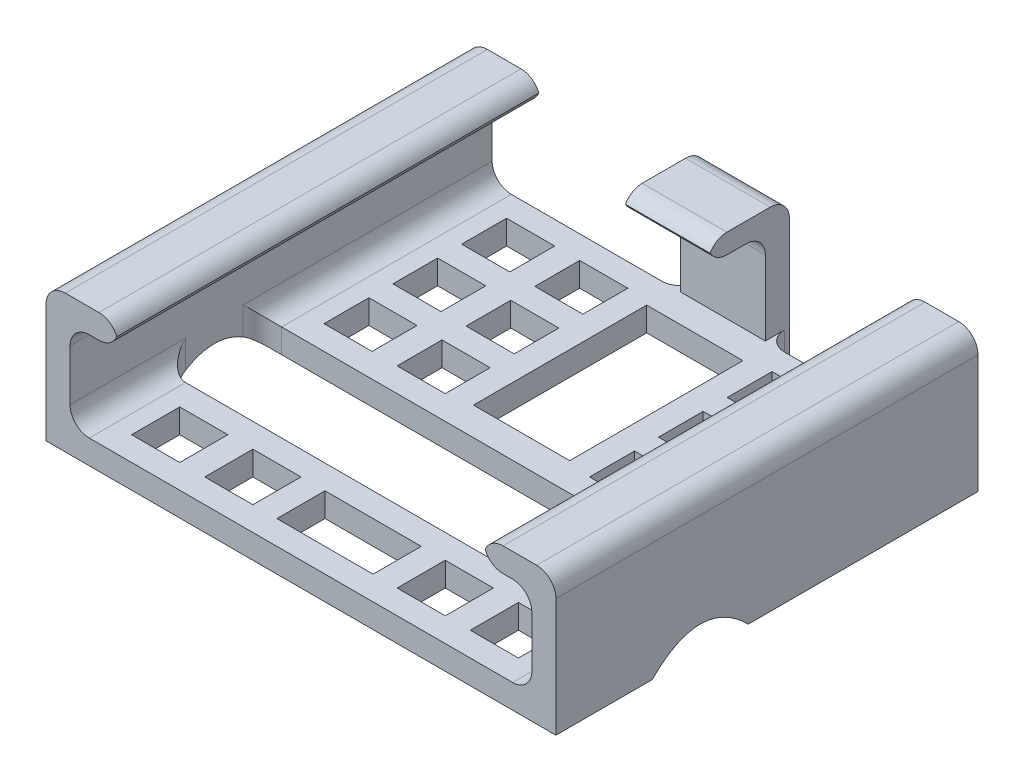
from build123d import *

# Parameters (mm, degrees)
SKETCH1_W                = 27.858627607
SKETCH1_H                = 1.5875
BOSS_EXTRUDE1_DEPTH      = 3.175
BOSS_EXTRUDE2_DEPTH      = 7.493
BOSS_EXTRUDE2_DEPTH_BACK = 1.5875
SKETCH2_W                = 1.5875
SKETCH2_H                = 27.858627607
SKETCH6_W                = 15.161065851
SKETCH6_H                = 1.5875
SKETCH6_W_2              = 6.350812748
BOSS_EXTRUDE3_DEPTH      = 30.48
SKETCH8_W                = 3.175
SKETCH8_H                = 2.963333334
SKETCH8_H_2              = 2.947899184
SKETCH8_W_2              = 6.35
SKETCH8_H_3              = 11.43
SKETCH8_H_4              = 3.175812748
SKETCH8_H_5              = 2.963333333
CUT_EXTRUDE5_DEPTH       = 1.5875
SKETCH9_W                = 5.588
SKETCH9_H                = 1.5875
BOSS_EXTRUDE4_DEPTH      = 1.5875
SKETCH10_W               = 5.588
SKETCH10_H               = 1.5875
BOSS_EXTRUDE5_DEPTH      = 7.493
SKETCH11_W               = 5.588
SKETCH11_H               = 1.299643063
BOSS_EXTRUDE6_DEPTH      = 3.81
FILLET1_R                = 1.27
CUT_EXTRUDE6_DEPTH       = 33.02
CUT_EXTRUDE6_DEPTH_BACK  = 2.54


with BuildPart() as part:
    # Sketch1 → Boss-Extrude1 (new body)
    with BuildSketch(Plane(origin=(15.758285748, 0, 0), x_dir=(0, 0, -1), z_dir=(1, 0, 0))):
        with Locations((-0.057440838, -17.304581801)):
            Rectangle(SKETCH1_W, SKETCH1_H)
    extrude(amount=-BOSS_EXTRUDE1_DEPTH)

    # Sketch2 → Boss-Extrude2 (add, two sides: drawn at the far end of the back side and taken through both)
    with BuildSketch(Plane.XZ.offset(18.098331801).offset(-BOSS_EXTRUDE2_DEPTH_BACK)):
        with Locations((16.552035748, 0.057440838)):
            Rectangle(SKETCH2_W, SKETCH2_H)
    extrude(amount=BOSS_EXTRUDE2_DEPTH + BOSS_EXTRUDE2_DEPTH_BACK)


with BuildPart() as body_2:
    # Mirror5: mirrored copy
    add(part.part.mirror(Plane(origin=(0.518285748, 0, 0), x_dir=(0, 0, 1), z_dir=(1, 0, 0))))


with BuildPart() as part_1:
    add(part.part)

    add(body_2.part)  # Boss-Extrude3 merges body 2
    # Sketch6 → Boss-Extrude3 (add)
    with BuildSketch(Plane.ZY.offset(-15.758285748)):
        with Locations((-6.29134004, -24.797581801)):
            Rectangle(SKETCH6_W, SKETCH6_H)
        with Locations((10.811348268, -24.797581801)):
            Rectangle(SKETCH6_W_2, SKETCH6_H)
    extrude(amount=BOSS_EXTRUDE3_DEPTH)

    # Sketch8 → Cut-Extrude5 (cut)
    with BuildSketch(Plane(origin=(0, -24.003831801, 0), x_dir=(1, 0, 0), z_dir=(0, 1, 0))):
        with Locations((-10.657714252, 1.779973781)):
            Rectangle(SKETCH8_W, SKETCH8_H)
        with Locations((-10.657714252, 6.32309004)):
            Rectangle(SKETCH8_W, SKETCH8_H_2)
        with Locations((0.518285748, 6.29134004)):
            Rectangle(SKETCH8_W_2, SKETCH8_H_3)
        with Locations((-5.831714252, 1.779973781)):
            Rectangle(SKETCH8_W, SKETCH8_H)
        with Locations((-10.657714252, -10.811348268)):
            Rectangle(SKETCH8_W, SKETCH8_H_4)
        with Locations((-5.831714252, 6.32309004)):
            Rectangle(SKETCH8_W, SKETCH8_H_2)
        with Locations((-5.831714252, 10.866206298)):
            Rectangle(SKETCH8_W, SKETCH8_H_5)
        with Locations((-10.657714252, 10.866206298)):
            Rectangle(SKETCH8_W, SKETCH8_H_5)
        with Locations((11.694285748, 10.866206298)):
            Rectangle(SKETCH8_W, SKETCH8_H_5)
        with Locations((6.868285748, 10.866206298)):
            Rectangle(SKETCH8_W, SKETCH8_H_5)
        with Locations((6.868285748, 6.32309004)):
            Rectangle(SKETCH8_W, SKETCH8_H_2)
        with Locations((11.694285748, 6.32309004)):
            Rectangle(SKETCH8_W, SKETCH8_H_2)
        with Locations((6.868285748, 1.779973781)):
            Rectangle(SKETCH8_W, SKETCH8_H)
        with Locations((11.694285748, 1.779973781)):
            Rectangle(SKETCH8_W, SKETCH8_H)
        with Locations((-5.831714252, -10.811348268)):
            Rectangle(SKETCH8_W, SKETCH8_H_4)
        with Locations((6.868285748, -10.811348268)):
            Rectangle(SKETCH8_W, SKETCH8_H_4)
        with Locations((11.694285748, -10.811348268)):
            Rectangle(SKETCH8_W, SKETCH8_H_4)
        with Locations((0.518285748, -10.811348268)):
            Rectangle(SKETCH8_W_2, SKETCH8_H_4)
    extrude(amount=-CUT_EXTRUDE5_DEPTH, mode=Mode.SUBTRACT)

    # Sketch9 → Boss-Extrude4 (add)
    with BuildSketch(Plane(origin=(0, 0, -13.871872965), x_dir=(-1, 0, 0), z_dir=(0, 0, -1))):
        with Locations((-0.518285748, -24.797581801)):
            Rectangle(SKETCH9_W, SKETCH9_H)
    extrude(amount=BOSS_EXTRUDE4_DEPTH)

    # Sketch10 → Boss-Extrude5 (add)
    with BuildSketch(Plane(origin=(0, -24.003831801, 0), x_dir=(1, 0, 0), z_dir=(0, 1, 0))):
        with Locations((0.518285748, 14.665622965)):
            Rectangle(SKETCH10_W, SKETCH10_H)
    extrude(amount=BOSS_EXTRUDE5_DEPTH)

    # Sketch11 → Boss-Extrude6 (add)
    with BuildSketch(Plane.XY.offset(-13.871872965)):
        with Locations((0.518285748, -17.160653333)):
            Rectangle(SKETCH11_W, SKETCH11_H)
    extrude(amount=BOSS_EXTRUDE6_DEPTH)

    # Fillet1
    # the kernel refuses this fillet: 1.27 mm, written as the material it adds along each edge
    with BuildSketch(Plane(origin=(-14.721714252, -18.098331801, 13.986754642), x_dir=(1, 0, 0), z_dir=(0, 0, -1)), Plane(origin=(15.758285748, -18.098331801, 13.986754642), x_dir=(0, -1, 0), z_dir=(0, 0, -1))) as fillet1_piece_1:
        with BuildLine():
            CenterArc((FILLET1_R, FILLET1_R), FILLET1_R, 180, 90)
            Line((0, FILLET1_R), (-FILLET1_R * 0.02, FILLET1_R))
            Line((-FILLET1_R * 0.02, FILLET1_R), (-FILLET1_R * 0.02, -FILLET1_R * 0.02))
            Line((-FILLET1_R * 0.02, -FILLET1_R * 0.02), (FILLET1_R, -FILLET1_R * 0.02))
            Line((FILLET1_R, -FILLET1_R * 0.02), (FILLET1_R, 0))
        make_face()
    extrude(amount=27.858627606)
    with BuildSketch(Plane(origin=(15.758285748, -24.003831801, 7.635941894), x_dir=(-1, 0, 0), z_dir=(0, 0, 1))) as fillet1_piece_2:
        with BuildLine():
            CenterArc((FILLET1_R, -FILLET1_R), FILLET1_R, 90, 90)
            Line((0, -FILLET1_R), (-FILLET1_R * 0.02, -FILLET1_R))
            Line((-FILLET1_R * 0.02, -FILLET1_R), (-FILLET1_R * 0.02, FILLET1_R * 0.02))
            Line((-FILLET1_R * 0.02, FILLET1_R * 0.02), (FILLET1_R, FILLET1_R * 0.02))
            Line((FILLET1_R, FILLET1_R * 0.02), (FILLET1_R, 0))
        make_face()
    extrude(amount=6.350812748)
    with BuildSketch(Plane(origin=(-14.721714252, -24.003831801, 7.635941894), x_dir=(1, 0, 0), z_dir=(0, 0, 1))) as fillet1_piece_3:
        with BuildLine():
            CenterArc((FILLET1_R, FILLET1_R), FILLET1_R, 180, 90)
            Line((0, FILLET1_R), (-FILLET1_R * 0.02, FILLET1_R))
            Line((-FILLET1_R * 0.02, FILLET1_R), (-FILLET1_R * 0.02, -FILLET1_R * 0.02))
            Line((-FILLET1_R * 0.02, -FILLET1_R * 0.02), (FILLET1_R, -FILLET1_R * 0.02))
            Line((FILLET1_R, -FILLET1_R * 0.02), (FILLET1_R, 0))
        make_face()
    extrude(amount=6.350812748)
    with BuildSketch(Plane(origin=(15.758285748, -25.591331801, 7.635941894), x_dir=(-1, 0, 0), z_dir=(0, 1, 0)), Plane(origin=(15.758285748, -25.591331801, 1.289192886), x_dir=(0, 0, 1), z_dir=(0, 1, 0)), Plane(origin=(-14.721714252, -25.591331801, 1.289192886), x_dir=(1, 0, 0), z_dir=(0, 1, 0))) as fillet1_piece_4:
        with BuildLine():
            CenterArc((FILLET1_R, -FILLET1_R), FILLET1_R, 90, 90)
            Line((0, -FILLET1_R), (-FILLET1_R * 0.02, -FILLET1_R))
            Line((-FILLET1_R * 0.02, -FILLET1_R), (-FILLET1_R * 0.02, FILLET1_R * 0.02))
            Line((-FILLET1_R * 0.02, FILLET1_R * 0.02), (FILLET1_R, FILLET1_R * 0.02))
            Line((FILLET1_R, FILLET1_R * 0.02), (FILLET1_R, 0))
        make_face()
    extrude(amount=1.5875)
    with BuildSketch(Plane(origin=(-14.721714252, -25.591331801, 7.635941894), x_dir=(1, 0, 0), z_dir=(0, 1, 0))) as fillet1_piece_5:
        with BuildLine():
            CenterArc((FILLET1_R, FILLET1_R), FILLET1_R, 180, 90)
            Line((0, FILLET1_R), (-FILLET1_R * 0.02, FILLET1_R))
            Line((-FILLET1_R * 0.02, FILLET1_R), (-FILLET1_R * 0.02, -FILLET1_R * 0.02))
            Line((-FILLET1_R * 0.02, -FILLET1_R * 0.02), (FILLET1_R, -FILLET1_R * 0.02))
            Line((FILLET1_R, -FILLET1_R * 0.02), (FILLET1_R, 0))
        make_face()
    extrude(amount=1.5875)
    with BuildSketch(Plane(origin=(15.758285748, -24.003831801, 1.289192886), x_dir=(0, 1, 0), z_dir=(0, 0, -1)), Plane(origin=(-14.721714252, -24.003831801, 1.289192886), x_dir=(1, 0, 0), z_dir=(0, 0, -1))) as fillet1_piece_6:
        with BuildLine():
            CenterArc((FILLET1_R, -FILLET1_R), FILLET1_R, 90, 90)
            Line((0, -FILLET1_R), (-FILLET1_R * 0.02, -FILLET1_R))
            Line((-FILLET1_R * 0.02, -FILLET1_R), (-FILLET1_R * 0.02, FILLET1_R * 0.02))
            Line((-FILLET1_R * 0.02, FILLET1_R * 0.02), (FILLET1_R, FILLET1_R * 0.02))
            Line((FILLET1_R, FILLET1_R * 0.02), (FILLET1_R, 0))
        make_face()
    extrude(amount=15.16106585)
    with BuildSketch(Plane(origin=(-2.275714252, -17.810474864, -13.871872965), x_dir=(0, -1, 0), z_dir=(1, 0, 0))) as fillet1_piece_7:
        with BuildLine():
            CenterArc((FILLET1_R, -FILLET1_R), FILLET1_R, 90, 90)
            Line((0, -FILLET1_R), (-FILLET1_R * 0.02, -FILLET1_R))
            Line((-FILLET1_R * 0.02, -FILLET1_R), (-FILLET1_R * 0.02, FILLET1_R * 0.02))
            Line((-FILLET1_R * 0.02, FILLET1_R * 0.02), (FILLET1_R, FILLET1_R * 0.02))
            Line((FILLET1_R, FILLET1_R * 0.02), (FILLET1_R, 0))
        make_face()
    extrude(amount=5.588)
    with BuildSketch(Plane(origin=(-2.275714252, -25.591331801, -13.871872965), x_dir=(0, 0, -1), z_dir=(0, 1, 0))) as fillet1_piece_8_section:
        with BuildLine():
            CenterArc((FILLET1_R, FILLET1_R), FILLET1_R, 180, 90)
            Line((0, FILLET1_R), (-FILLET1_R * 0.02, FILLET1_R))
            Line((-FILLET1_R * 0.02, FILLET1_R), (-FILLET1_R * 0.02, -FILLET1_R * 0.02))
            Line((-FILLET1_R * 0.02, -FILLET1_R * 0.02), (FILLET1_R, -FILLET1_R * 0.02))
            Line((FILLET1_R, -FILLET1_R * 0.02), (FILLET1_R, 0))
        make_face()
    fillet1_piece_8 = extrude(amount=1.5875, mode=Mode.PRIVATE)
    fillet1_piece_8 = split(fillet1_piece_8, bisect_by=Plane(origin=(-2.534125127, -24.797581801, -13.871872965), z_dir=(0, 0, -1)), keep=Keep.TOP, mode=Mode.PRIVATE)
    add(fillet1_piece_8)
    with BuildSketch(Plane(origin=(3.312285748, -24.003831801, -13.871872965), x_dir=(0, 0, -1), z_dir=(0, -1, 0))) as fillet1_piece_9_section:
        with BuildLine():
            CenterArc((FILLET1_R, FILLET1_R), FILLET1_R, 180, 90)
            Line((0, FILLET1_R), (-FILLET1_R * 0.02, FILLET1_R))
            Line((-FILLET1_R * 0.02, FILLET1_R), (-FILLET1_R * 0.02, -FILLET1_R * 0.02))
            Line((-FILLET1_R * 0.02, -FILLET1_R * 0.02), (FILLET1_R, -FILLET1_R * 0.02))
            Line((FILLET1_R, -FILLET1_R * 0.02), (FILLET1_R, 0))
        make_face()
    fillet1_piece_9 = extrude(amount=1.5875, mode=Mode.PRIVATE)
    fillet1_piece_9 = split(fillet1_piece_9, bisect_by=Plane(origin=(3.570696623, -24.797581801, -13.871872965), z_dir=(0, 0, -1)), keep=Keep.TOP, mode=Mode.PRIVATE)
    add(fillet1_piece_9)
    with BuildSketch(Plane(origin=(15.758285748, -24.003831801, 4.460941894), x_dir=(-1, 0, 0), z_dir=(0, 0, 1))) as fillet1_piece_10a_section:
        with BuildLine():
            CenterArc((FILLET1_R, -FILLET1_R), FILLET1_R, 90, 90)
            Line((0, -FILLET1_R), (-FILLET1_R * 0.02, -FILLET1_R))
            Line((-FILLET1_R * 0.02, -FILLET1_R), (-FILLET1_R * 0.02, FILLET1_R * 0.02))
            Line((-FILLET1_R * 0.02, FILLET1_R * 0.02), (FILLET1_R, FILLET1_R * 0.02))
            Line((FILLET1_R, FILLET1_R * 0.02), (FILLET1_R, 0))
        make_face()
    fillet1_piece_10a = extrude(amount=9.525812748, mode=Mode.PRIVATE)
    fillet1_piece_10a = split(fillet1_piece_10a, bisect_by=Plane(origin=(15.470763953, -23.716310006, 7.635941894), z_dir=(0, 0, -1)), keep=Keep.TOP, mode=Mode.PRIVATE)
    with BuildSketch(Plane(origin=(15.758285748, -25.591331801, 7.635941894), x_dir=(-1, 0, 0), z_dir=(0, 1, 0))) as fillet1_piece_10b_section:
        with BuildLine():
            CenterArc((FILLET1_R, -FILLET1_R), FILLET1_R, 90, 90)
            Line((0, -FILLET1_R), (-FILLET1_R * 0.02, -FILLET1_R))
            Line((-FILLET1_R * 0.02, -FILLET1_R), (-FILLET1_R * 0.02, FILLET1_R * 0.02))
            Line((-FILLET1_R * 0.02, FILLET1_R * 0.02), (FILLET1_R, FILLET1_R * 0.02))
            Line((FILLET1_R, FILLET1_R * 0.02), (FILLET1_R, 0))
        make_face()
    fillet1_piece_10b = extrude(amount=4.7625, mode=Mode.PRIVATE)
    fillet1_piece_10b = split(fillet1_piece_10b, bisect_by=Plane(origin=(15.470763953, -24.003831801, 7.348420099), z_dir=(0, 1, 0)), keep=Keep.TOP, mode=Mode.PRIVATE)
    fillet1_piece_10 = fillet1_piece_10a & fillet1_piece_10b
    add(fillet1_piece_10)
    with BuildSketch(Plane(origin=(-14.721714252, -24.003831801, 4.460941894), x_dir=(1, 0, 0), z_dir=(0, 0, 1))) as fillet1_piece_11a_section:
        with BuildLine():
            CenterArc((FILLET1_R, FILLET1_R), FILLET1_R, 180, 90)
            Line((0, FILLET1_R), (-FILLET1_R * 0.02, FILLET1_R))
            Line((-FILLET1_R * 0.02, FILLET1_R), (-FILLET1_R * 0.02, -FILLET1_R * 0.02))
            Line((-FILLET1_R * 0.02, -FILLET1_R * 0.02), (FILLET1_R, -FILLET1_R * 0.02))
            Line((FILLET1_R, -FILLET1_R * 0.02), (FILLET1_R, 0))
        make_face()
    fillet1_piece_11a = extrude(amount=9.525812748, mode=Mode.PRIVATE)
    fillet1_piece_11a = split(fillet1_piece_11a, bisect_by=Plane(origin=(-14.434192457, -23.716310006, 7.635941894), z_dir=(0, 0, -1)), keep=Keep.TOP, mode=Mode.PRIVATE)
    with BuildSketch(Plane(origin=(-14.721714252, -25.591331801, 7.635941894), x_dir=(1, 0, 0), z_dir=(0, 1, 0))) as fillet1_piece_11b_section:
        with BuildLine():
            CenterArc((FILLET1_R, FILLET1_R), FILLET1_R, 180, 90)
            Line((0, FILLET1_R), (-FILLET1_R * 0.02, FILLET1_R))
            Line((-FILLET1_R * 0.02, FILLET1_R), (-FILLET1_R * 0.02, -FILLET1_R * 0.02))
            Line((-FILLET1_R * 0.02, -FILLET1_R * 0.02), (FILLET1_R, -FILLET1_R * 0.02))
            Line((FILLET1_R, -FILLET1_R * 0.02), (FILLET1_R, 0))
        make_face()
    fillet1_piece_11b = extrude(amount=4.7625, mode=Mode.PRIVATE)
    fillet1_piece_11b = split(fillet1_piece_11b, bisect_by=Plane(origin=(-14.434192457, -24.003831801, 7.348420099), z_dir=(0, 1, 0)), keep=Keep.TOP, mode=Mode.PRIVATE)
    fillet1_piece_11 = fillet1_piece_11a & fillet1_piece_11b
    add(fillet1_piece_11)
    with BuildSketch(Plane(origin=(15.758285748, -24.003831801, 4.464192886), x_dir=(0, 1, 0), z_dir=(0, 0, -1))) as fillet1_piece_12a_section:
        with BuildLine():
            CenterArc((FILLET1_R, -FILLET1_R), FILLET1_R, 90, 90)
            Line((0, -FILLET1_R), (-FILLET1_R * 0.02, -FILLET1_R))
            Line((-FILLET1_R * 0.02, -FILLET1_R), (-FILLET1_R * 0.02, FILLET1_R * 0.02))
            Line((-FILLET1_R * 0.02, FILLET1_R * 0.02), (FILLET1_R, FILLET1_R * 0.02))
            Line((FILLET1_R, FILLET1_R * 0.02), (FILLET1_R, 0))
        make_face()
    fillet1_piece_12a = extrude(amount=18.33606585, mode=Mode.PRIVATE)
    fillet1_piece_12a = split(fillet1_piece_12a, bisect_by=Plane(origin=(15.470763953, -23.716310006, 1.289192886), z_dir=(0, 0, 1)), keep=Keep.TOP, mode=Mode.PRIVATE)
    with BuildSketch(Plane(origin=(15.758285748, -25.591331801, 1.289192886), x_dir=(0, 0, 1), z_dir=(0, 1, 0))) as fillet1_piece_12b_section:
        with BuildLine():
            CenterArc((FILLET1_R, -FILLET1_R), FILLET1_R, 90, 90)
            Line((0, -FILLET1_R), (-FILLET1_R * 0.02, -FILLET1_R))
            Line((-FILLET1_R * 0.02, -FILLET1_R), (-FILLET1_R * 0.02, FILLET1_R * 0.02))
            Line((-FILLET1_R * 0.02, FILLET1_R * 0.02), (FILLET1_R, FILLET1_R * 0.02))
            Line((FILLET1_R, FILLET1_R * 0.02), (FILLET1_R, 0))
        make_face()
    fillet1_piece_12b = extrude(amount=4.7625, mode=Mode.PRIVATE)
    fillet1_piece_12b = split(fillet1_piece_12b, bisect_by=Plane(origin=(15.470763953, -24.003831801, 1.576714681), z_dir=(0, 1, 0)), keep=Keep.TOP, mode=Mode.PRIVATE)
    fillet1_piece_12 = fillet1_piece_12a & fillet1_piece_12b
    add(fillet1_piece_12)
    with BuildSketch(Plane(origin=(-14.721714252, -24.003831801, 4.464192886), x_dir=(1, 0, 0), z_dir=(0, 0, -1))) as fillet1_piece_13a_section:
        with BuildLine():
            CenterArc((FILLET1_R, -FILLET1_R), FILLET1_R, 90, 90)
            Line((0, -FILLET1_R), (-FILLET1_R * 0.02, -FILLET1_R))
            Line((-FILLET1_R * 0.02, -FILLET1_R), (-FILLET1_R * 0.02, FILLET1_R * 0.02))
            Line((-FILLET1_R * 0.02, FILLET1_R * 0.02), (FILLET1_R, FILLET1_R * 0.02))
            Line((FILLET1_R, FILLET1_R * 0.02), (FILLET1_R, 0))
        make_face()
    fillet1_piece_13a = extrude(amount=18.33606585, mode=Mode.PRIVATE)
    fillet1_piece_13a = split(fillet1_piece_13a, bisect_by=Plane(origin=(-14.434192457, -23.716310006, 1.289192886), z_dir=(0, 0, 1)), keep=Keep.TOP, mode=Mode.PRIVATE)
    with BuildSketch(Plane(origin=(-14.721714252, -25.591331801, 1.289192886), x_dir=(1, 0, 0), z_dir=(0, 1, 0))) as fillet1_piece_13b_section:
        with BuildLine():
            CenterArc((FILLET1_R, -FILLET1_R), FILLET1_R, 90, 90)
            Line((0, -FILLET1_R), (-FILLET1_R * 0.02, -FILLET1_R))
            Line((-FILLET1_R * 0.02, -FILLET1_R), (-FILLET1_R * 0.02, FILLET1_R * 0.02))
            Line((-FILLET1_R * 0.02, FILLET1_R * 0.02), (FILLET1_R, FILLET1_R * 0.02))
            Line((FILLET1_R, FILLET1_R * 0.02), (FILLET1_R, 0))
        make_face()
    fillet1_piece_13b = extrude(amount=4.7625, mode=Mode.PRIVATE)
    fillet1_piece_13b = split(fillet1_piece_13b, bisect_by=Plane(origin=(-14.434192457, -24.003831801, 1.576714681), z_dir=(0, 1, 0)), keep=Keep.TOP, mode=Mode.PRIVATE)
    fillet1_piece_13 = fillet1_piece_13a & fillet1_piece_13b
    add(fillet1_piece_13)
    # the kernel refuses this fillet: 1.27 mm, written as the material it takes off along each edge
    with BuildSketch(Plane(origin=(-11.546714252, -18.098331801, 13.986754642), x_dir=(0, 1, 0), z_dir=(0, 0, -1)), Plane(origin=(12.583285748, -18.098331801, 13.986754642), x_dir=(1, 0, 0), z_dir=(0, 0, -1))) as fillet1_2_piece_1:
        with BuildLine():
            CenterArc((FILLET1_R, -FILLET1_R), FILLET1_R, 90, 90)
            Line((0, -FILLET1_R), (-FILLET1_R * 0.02, -FILLET1_R))
            Line((-FILLET1_R * 0.02, -FILLET1_R), (-FILLET1_R * 0.02, FILLET1_R * 0.02))
            Line((-FILLET1_R * 0.02, FILLET1_R * 0.02), (FILLET1_R, FILLET1_R * 0.02))
            Line((FILLET1_R, FILLET1_R * 0.02), (FILLET1_R, 0))
        make_face()
    extrude(amount=27.858627606, mode=Mode.SUBTRACT)
    with BuildSketch(Plane(origin=(-11.546714252, -16.510831801, -13.871872965), x_dir=(-1, 0, 0), z_dir=(0, 0, 1)), Plane(origin=(-16.309214252, -16.510831801, -13.871872965), x_dir=(0, -1, 0), z_dir=(0, 0, 1)), Plane(origin=(12.583285748, -16.510831801, -13.871872965), x_dir=(0, -1, 0), z_dir=(0, 0, 1)), Plane(origin=(17.345785748, -16.510831801, -13.871872965), x_dir=(-1, 0, 0), z_dir=(0, 0, 1))) as fillet1_2_piece_2:
        with BuildLine():
            CenterArc((FILLET1_R, FILLET1_R), FILLET1_R, 180, 90)
            Line((0, FILLET1_R), (-FILLET1_R * 0.02, FILLET1_R))
            Line((-FILLET1_R * 0.02, FILLET1_R), (-FILLET1_R * 0.02, -FILLET1_R * 0.02))
            Line((-FILLET1_R * 0.02, -FILLET1_R * 0.02), (FILLET1_R, -FILLET1_R * 0.02))
            Line((FILLET1_R, -FILLET1_R * 0.02), (FILLET1_R, 0))
        make_face()
    extrude(amount=27.858627606, mode=Mode.SUBTRACT)
    with BuildSketch(Plane(origin=(-2.275714252, -17.810474864, -10.061872965), x_dir=(0, 0, -1), z_dir=(1, 0, 0))) as fillet1_2_piece_3:
        with BuildLine():
            CenterArc((FILLET1_R, FILLET1_R), FILLET1_R, 180, 90)
            Line((0, FILLET1_R), (-FILLET1_R * 0.02, FILLET1_R))
            Line((-FILLET1_R * 0.02, FILLET1_R), (-FILLET1_R * 0.02, -FILLET1_R * 0.02))
            Line((-FILLET1_R * 0.02, -FILLET1_R * 0.02), (FILLET1_R, -FILLET1_R * 0.02))
            Line((FILLET1_R, -FILLET1_R * 0.02), (FILLET1_R, 0))
        make_face()
    extrude(amount=5.588, mode=Mode.SUBTRACT)
    with BuildSketch(Plane(origin=(3.312285748, -16.510831801, -10.061872965), x_dir=(0, -1, 0), z_dir=(-1, 0, 0)), Plane(origin=(3.312285748, -16.510831801, -15.459372965), x_dir=(0, 0, 1), z_dir=(-1, 0, 0))) as fillet1_2_piece_4:
        with BuildLine():
            CenterArc((FILLET1_R, -FILLET1_R), FILLET1_R, 90, 90)
            Line((0, -FILLET1_R), (-FILLET1_R * 0.02, -FILLET1_R))
            Line((-FILLET1_R * 0.02, -FILLET1_R), (-FILLET1_R * 0.02, FILLET1_R * 0.02))
            Line((-FILLET1_R * 0.02, FILLET1_R * 0.02), (FILLET1_R, FILLET1_R * 0.02))
            Line((FILLET1_R, FILLET1_R * 0.02), (FILLET1_R, 0))
        make_face()
    extrude(amount=5.588, mode=Mode.SUBTRACT)

    # Sketch12 → Cut-Extrude6 (cut, two sides: drawn at the far end of the back side and taken through both)
    with BuildSketch(Plane.ZY.offset(-15.758285748).offset(-CUT_EXTRUDE6_DEPTH_BACK)):
        with BuildLine():
            Line((1.289192886, -25.591331801), (7.635941894, -25.591331801))
            add(Edge.make_bspline(
                [(1.289192886, -25.591331801), (4.46256739, -22.416331801), (7.635941894, -25.591331801)],
                knots=[0, 0, 0, 1, 1, 1], degree=2))
        make_face()
    extrude(amount=CUT_EXTRUDE6_DEPTH + CUT_EXTRUDE6_DEPTH_BACK, mode=Mode.SUBTRACT)


solid = part_1.part
